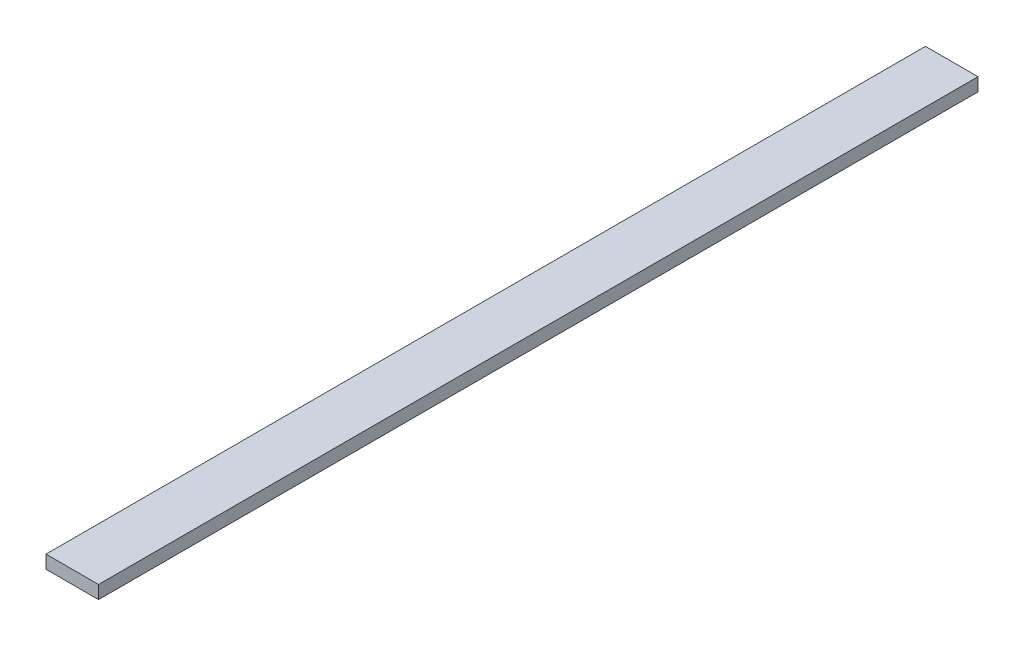
from build123d import *

# Parameters (mm, degrees)
SKETCH1_W           = 19.05
SKETCH1_H           = 4.7625
BOSS_EXTRUDE1_DEPTH = 343.95
SKETCH2_W           = 25.134104855
SKETCH2_H           = 4.7625
CUT_EXTRUDE1_DEPTH  = 345.510067206


with BuildPart() as part:
    # Sketch1 → Boss-Extrude1 (new body)
    with BuildSketch(Plane.XY):
        with Locations((9.525, 2.38125)):
            Rectangle(SKETCH1_W, SKETCH1_H)
    extrude(amount=BOSS_EXTRUDE1_DEPTH)

    # Sketch2 → Cut-Extrude1 (cut, through all)
    with BuildSketch(Plane(origin=(19.05, 0, 0), x_dir=(0, 0, -1), z_dir=(1, 0, 0))):
        with Locations((-12.567052428, 2.38125)):
            Rectangle(SKETCH2_W, SKETCH2_H)
    extrude(amount=-CUT_EXTRUDE1_DEPTH, mode=Mode.SUBTRACT)


solid = part.part
